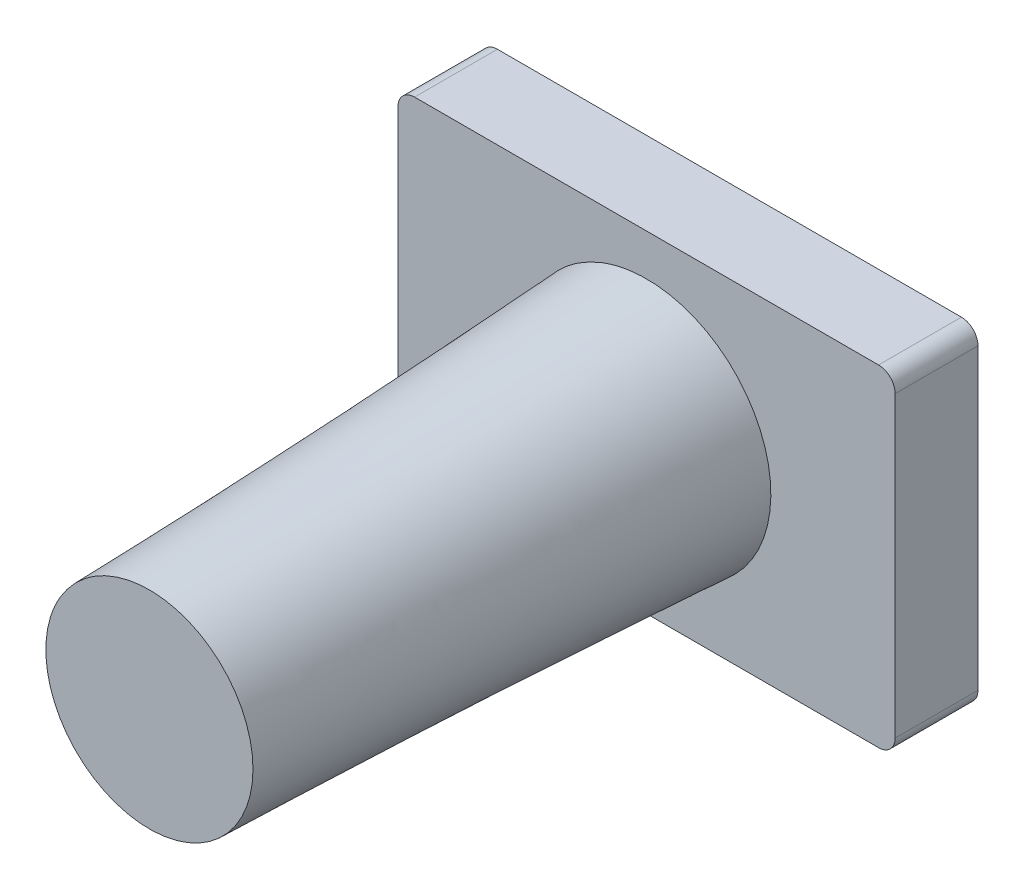
from build123d import *

# Parameters (mm, degrees)
BOSS_EXTRUDE3_DEPTH   = 100
BODY_MOVE_COPY2_ANGLE = 90


with BuildPart() as part:
    # Sketch4 → Boss-Extrude3 (new body)
    with BuildSketch(Plane(origin=(0, 0, 0), x_dir=(1, 0, 0), z_dir=(0, 1, 0))):
        with BuildLine():
            Line((-280, 200), (280, 200))
            ThreePointArc((280, 200), (294.142135624, 194.142135624), (300, 180))
            Line((300, 180), (300, -180))
            ThreePointArc((300, -180), (294.142135624, -194.142135624), (280, -200))
            Line((280, -200), (-280, -200))
            ThreePointArc((-280, -200), (-294.142135624, -194.142135624), (-300, -180))
            Line((-300, -180), (-300, 180))
            ThreePointArc((-300, 180), (-294.142135624, 194.142135624), (-280, 200))
        make_face()
    extrude(amount=BOSS_EXTRUDE3_DEPTH)

    # Loft1: read off the stored shape, not the designer's step
    # Loft1: loft between two sections, ruled curve by curve
    loft1_from = [
        Edge.make_bspline([(94.538797531, 700, 81.776621117), (-69.014444703, 700, 270.85421618), (-258.092039765, 700, 107.300973946), (-94.538797531, 700, -81.776621117), (69.014444703, 700, -270.85421618), (258.092039765, 700, -107.300973946), (94.538797531, 700, 81.776621117)], [0, 0, 0, 0, 0.5, 0.5, 0.5, 1, 1, 1, 1], 3, [1, 0.333333333, 0.333333333, 1, 0.333333333, 0.333333333, 1]),
    ]
    loft1_to = [
        Edge.make_bspline([(67.762458695, 100, 133.821706728), (-199.880954762, 100, 269.346624118), (-335.405872151, 100, 1.703210661), (-67.762458695, 100, -133.821706728), (199.880954762, 100, -269.346624118), (335.405872151, 100, -1.703210661), (67.762458695, 100, 133.821706728)], [0, 0, 0, 0, 0.5, 0.5, 0.5, 1, 1, 1, 1], 3, [1, 0.333333333, 0.333333333, 1, 0.333333333, 0.333333333, 1]),
    ]
    loft1 = Solid(Shell([*[Face.make_surface_from_curves(loft1_from[k], loft1_to[k]) for k in range(1)], Face(Wire(loft1_from)), Face(Wire(loft1_to))]))
    add(loft1)


with BuildPart() as part_1:
    # Body-Move/Copy2: moved
    add(part.part.rotate(Axis((0, 0, 0), (1, 0, 0)), BODY_MOVE_COPY2_ANGLE))


solid = part_1.part
